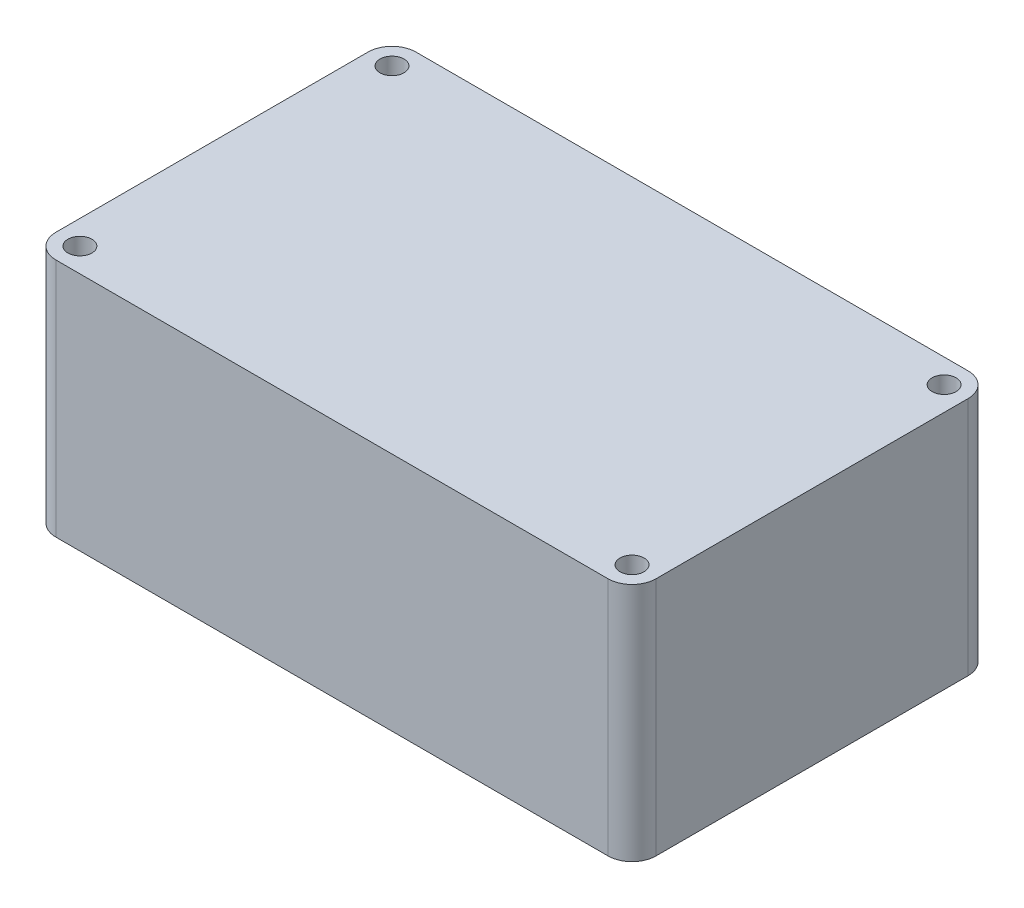
from build123d import *

# Parameters (mm, degrees)
CROQUIS1_W                                 = 250
CROQUIS1_H                                 = 150
SALIENTE_EXTRUIR1_DEPTH                    = 100
REDONDEO1_R                                = 10
CROQUIS2_R                                 = 5
CORTAR_EXTRUIR1_DEPTH                      = 177.776695297
SIMETR_A1_AT_THE_SECOND_PLANE_COPY_1_SKE_R = 5
SIMETR_A1_AT_THE_SECOND_PLANE_COPY_1_DEPTH = 177.776695297


with BuildPart() as part:
    # Croquis1 → Saliente-Extruir1 (new body)
    with BuildSketch(Plane(origin=(0, 0, 0), x_dir=(1, 0, 0), z_dir=(0, 1, 0))):
        Rectangle(CROQUIS1_W, CROQUIS1_H)
    extrude(amount=SALIENTE_EXTRUIR1_DEPTH)

    # Redondeo1
    redondeo1_edges = [part.edges().sort_by_distance(p)[0] for p in [
        (-125, 50, -75),
        (125, 50, -75),
        (125, 50, 75),
        (-125, 50, 75),
    ]]
    fillet(redondeo1_edges, radius=REDONDEO1_R)

    # Croquis2 → Cortar-Extruir1 (cut, through all)
    with BuildSketch(Plane(origin=(0, 100, 0), x_dir=(1, 0, 0), z_dir=(0, 1, 0))):
        with Locations((-115, 65)):
            Circle(CROQUIS2_R)
    cortar_extruir1 = extrude(amount=-CORTAR_EXTRUIR1_DEPTH, mode=Mode.SUBTRACT)

    # Simetría1: Cortar-Extruir1 across plane
    add(cortar_extruir1.mirror(Plane.XY), mode=Mode.SUBTRACT)

    # Simetría1 at the second plane: Cortar-Extruir1 across plane
    add(cortar_extruir1.mirror(Plane(origin=(0, 0, 0), x_dir=(0, 0, 1), z_dir=(1, 0, 0))), mode=Mode.SUBTRACT)

    # Simetría1 at the second plane copy 1 ske → Simetría1 at the second plane copy 1 (cut, through all)
    with BuildSketch(Plane(origin=(0, 100, 0), x_dir=(-1, 0, 0), z_dir=(0, 1, 0))):
        with Locations((-115, 65)):
            Circle(SIMETR_A1_AT_THE_SECOND_PLANE_COPY_1_SKE_R)
    extrude(amount=-SIMETR_A1_AT_THE_SECOND_PLANE_COPY_1_DEPTH, mode=Mode.SUBTRACT)


solid = part.part
